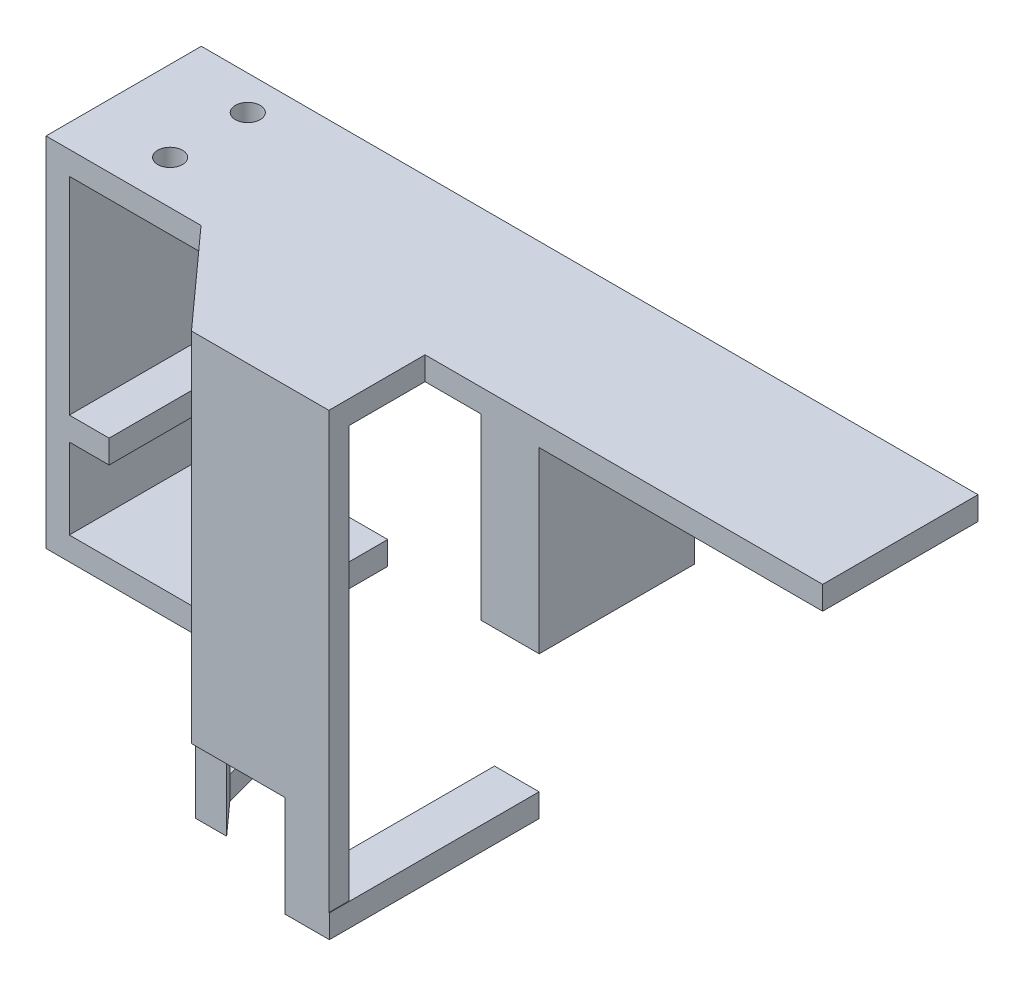
from build123d import *

# Parameters (mm, degrees)
SKETCH1_W            = 100
SKETCH1_H            = 20
BOSS_EXTRUDE1_DEPTH  = 3
BOSS_EXTRUDE3_DEPTH  = 20
SKETCH8_W            = 24
SKETCH8_H            = 3
BOSS_EXTRUDE6_DEPTH  = 20
SKETCH10_W           = 6
SKETCH10_H           = 3
BOSS_EXTRUDE9_DEPTH  = 20
SKETCH12_R           = 1.6
CUT_EXTRUDE1_DEPTH   = 80
SKETCH11_R           = 1.5
CUT_EXTRUDE2_DEPTH   = 20
SKETCH13_W           = 7.961309781
SKETCH13_H           = 15.301040779
BOSS_EXTRUDE10_DEPTH = 3
SKETCH14_W           = 7.464441808
SKETCH14_H           = 20
BOSS_EXTRUDE13_DEPTH = 23
BOSS_EXTRUDE15_DEPTH = 46
BOSS_EXTRUDE16_DEPTH = 3
SKETCH23_W           = 5.668418952
SKETCH23_H           = 2.605533234
BOSS_EXTRUDE17_DEPTH = 10
SKETCH24_W           = 5.736136368
SKETCH24_H           = 27
BOSS_EXTRUDE18_DEPTH = 3


with BuildPart() as part:
    # Sketch1 → Boss-Extrude1 (new body)
    with BuildSketch(Plane(origin=(0, 0, 0), x_dir=(1, 0, 0), z_dir=(0, 1, 0))):
        with Locations((50, 10)):
            Rectangle(SKETCH1_W, SKETCH1_H)
    extrude(amount=BOSS_EXTRUDE1_DEPTH)

    # Sketch4 → Boss-Extrude3 (add)
    with BuildSketch(Plane(origin=(0, 0, -20), x_dir=(-1, 0, 0), z_dir=(0, 0, -1))):
        Polygon((0, -43), (0, 0), (-3, 0), (-3, -24), (-3, -26.692100843), (-3, -43), align=None)
    extrude(amount=-BOSS_EXTRUDE3_DEPTH)

    # Sketch8 → Boss-Extrude6 (add)
    with BuildSketch(Plane(origin=(0, 0, -20), x_dir=(-1, 0, 0), z_dir=(0, 0, -1))):
        with Locations((-12, -41.5)):
            Rectangle(SKETCH8_W, SKETCH8_H)
    extrude(amount=-BOSS_EXTRUDE6_DEPTH)

    # Sketch10 → Boss-Extrude9 (add)
    with BuildSketch(Plane.XY):
        with Locations((5.126533602, -28.13)):
            Rectangle(SKETCH10_W, SKETCH10_H)
    extrude(amount=-BOSS_EXTRUDE9_DEPTH)

    # Sketch12 → Cut-Extrude1 (cut)
    with BuildSketch(Plane(origin=(0, -43, 0), x_dir=(-1, 0, 0), z_dir=(0, -1, 0))):
        with Locations((-10.38, 5.6)):
            Circle(SKETCH12_R)
        with Locations((-10.38, 15.6)):
            Circle(SKETCH12_R)
    extrude(amount=-CUT_EXTRUDE1_DEPTH, mode=Mode.SUBTRACT)

    # Sketch11 → Cut-Extrude2 (cut)
    with BuildSketch(Plane.XZ.offset(43)):
        with Locations((20.852680531, -10.165848845)):
            Circle(SKETCH11_R)
    extrude(amount=-CUT_EXTRUDE2_DEPTH, mode=Mode.SUBTRACT)

    # Sketch13 → Boss-Extrude10 (add)
    with BuildSketch(Plane.XZ.offset(43)):
        with Locations((9.051384729, -11.125007192)):
            Rectangle(SKETCH13_W, SKETCH13_H)
    extrude(amount=-BOSS_EXTRUDE10_DEPTH)

    # Sketch14 → Boss-Extrude13 (add)
    with BuildSketch(Plane(origin=(0, 0, 0), x_dir=(-1, 0, 0), z_dir=(0, -1, 0))):
        with Locations((-59.766859141, 10)):
            Rectangle(SKETCH14_W, SKETCH14_H)
    extrude(amount=BOSS_EXTRUDE13_DEPTH)

    # Sketch18 → Boss-Extrude15 (add)
    with BuildSketch(Plane.XZ.offset(43)):
        Polygon((24, 0), (32.80534196, 9.779322978), (48.80534196, 9.779322978), (48.80534196, 12.384856212), (31.114476432, 12.384856212), (19.963101811, 0), align=None)
    extrude(amount=-BOSS_EXTRUDE15_DEPTH)

    # Sketch19 → Boss-Extrude16 (add)
    with BuildSketch(Plane(origin=(0, 3, 0), x_dir=(1, 0, 0), z_dir=(0, 1, 0))):
        Polygon((24, 0), (32.80534196, -9.779322978), (48.80534196, -9.779322978), (48.80534196, 0.616391459), align=None)
    extrude(amount=-BOSS_EXTRUDE16_DEPTH)

    # Sketch23 → Boss-Extrude17 (add)
    with BuildSketch(Plane(origin=(0, -43, 0), x_dir=(-1, 0, 0), z_dir=(0, -1, 0))):
        with Locations((-45.971132484, -11.082089595)):
            Rectangle(SKETCH23_W, SKETCH23_H)
        Polygon((-26.681858511, -7.461935275), (-24.988138936, -3.381523976), (-27.044737864, -3.381523976), (-30.7187567, -7.461935275), align=None)
    extrude(amount=BOSS_EXTRUDE17_DEPTH)

    # Sketch24 → Boss-Extrude18 (add)
    with BuildSketch(Plane.XZ.offset(53)):
        Polygon((26.681858511, 7.461935275), (24.355213942, 1.856717664), (18.221282591, -12.920795191), (22.62199761, -12.920795191), (27.044737864, 3.381523976), (30.7187567, 7.461935275), align=None)
        with Locations((46.004991192, -1.115143788)):
            Rectangle(SKETCH24_W, SKETCH24_H)
    extrude(amount=BOSS_EXTRUDE18_DEPTH)


solid = part.part
